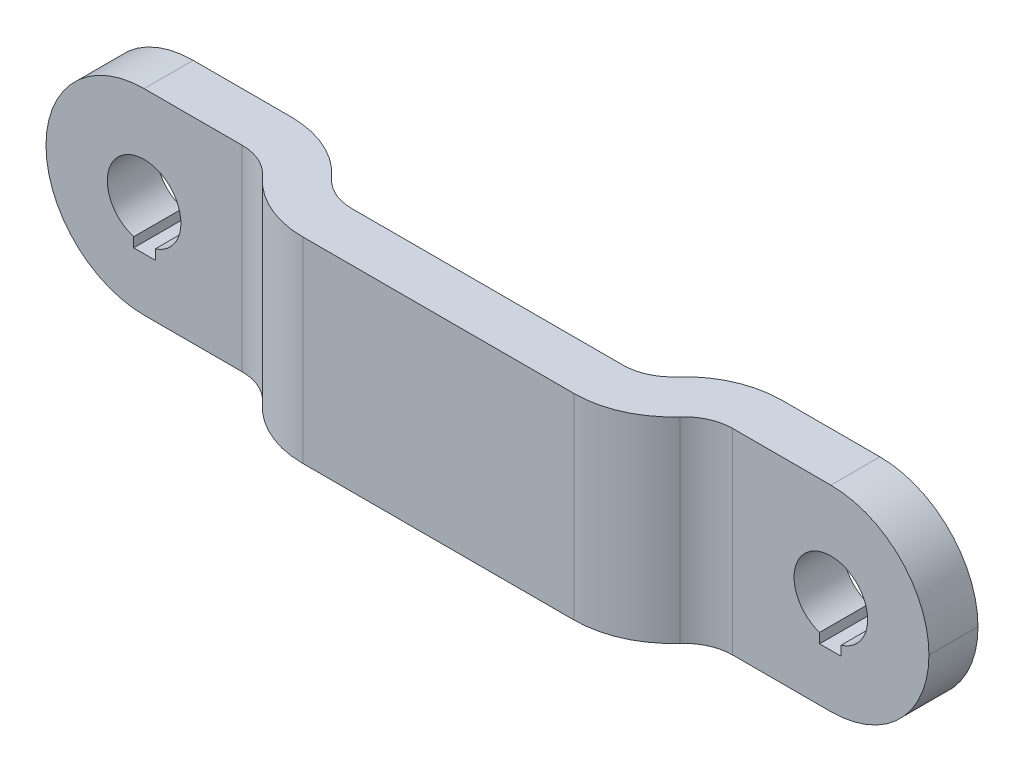
from build123d import *

# Parameters (mm, degrees)
BASE_EXTRUDE_DEPTH = 6.35
FILLET1_R          = 6.35
CUT_EXTRUDE1_DEPTH = 30.443738723


with BuildPart() as part:
    # Sketch1 → Base-Extrude (new, symmetric)
    with BuildSketch(Plane(origin=(0, 0, 0), x_dir=(1, 0, 0), z_dir=(0, 1, 0))):
        with BuildLine():
            Line((-28.575, 0), (-15.875, 0))
            ThreePointArc((-15.875, 0), (-13.282623356, -0.5532696), (-11.141989448, -2.116666667))
            ThreePointArc((-11.141989448, -2.116666667), (-10.071672494, -2.8983652), (-8.775484171, -3.175))
            Line((-8.775484171, -3.175), (8.775484171, -3.175))
            ThreePointArc((8.775484171, -3.175), (10.071672494, -2.8983652), (11.141989448, -2.116666667))
            ThreePointArc((11.141989448, -2.116666667), (13.282623356, -0.5532696), (15.875, 0))
            Line((15.875, 0), (28.575, 0))
            Line((28.575, 0), (28.575, -3.175))
            Line((28.575, -3.175), (15.875, -3.175))
            ThreePointArc((15.875, -3.175), (14.578811678, -3.4516348), (13.508494724, -4.233333333))
            ThreePointArc((13.508494724, -4.233333333), (11.367860816, -5.7967304), (8.775484171, -6.35))
            Line((8.775484171, -6.35), (-8.775484171, -6.35))
            ThreePointArc((-8.775484171, -6.35), (-11.367860816, -5.7967304), (-13.508494724, -4.233333333))
            ThreePointArc((-13.508494724, -4.233333333), (-14.578811678, -3.4516348), (-15.875, -3.175))
            Line((-15.875, -3.175), (-28.575, -3.175))
            Line((-28.575, -3.175), (-28.575, 0))
        make_face()
    extrude(amount=BASE_EXTRUDE_DEPTH, both=True)

    # Fillet1
    fillet1_edges = [part.edges().sort_by_distance(p)[0] for p in [
        (-28.575, 6.35, 1.5875),
        (28.575, 6.35, 1.5875),
        (28.575, -6.35, 1.5875),
        (-28.575, -6.35, 1.5875),
    ]]
    fillet(fillet1_edges, radius=FILLET1_R - 0.0001)  # a hair under: the kernel refuses the full size

    # Sketch2 → Cut-Extrude1 (cut, through all)
    with BuildSketch(Plane.XY.offset(3.175)):
        with BuildLine():
            Line((-22.895630041, -2.284864747), (-22.895630041, -2.908854561))
            Line((-22.895630041, -2.908854561), (-21.498676538, -2.908854561))
            Line((-21.498676538, -2.908854561), (-21.498676538, -2.267775516))
            ThreePointArc((-21.498676538, -2.267775516), (-22.254128161, 2.381071841), (-22.895630041, -2.284864747))
        make_face()
        with BuildLine():
            Line((21.498676538, -2.267775516), (21.498676538, -2.908854561))
            Line((21.498676538, -2.908854561), (22.895630041, -2.908854561))
            Line((22.895630041, -2.908854561), (22.895630041, -2.284864747))
            ThreePointArc((22.895630041, -2.284864747), (22.254128161, 2.381071841), (21.498676538, -2.267775516))
        make_face()
    extrude(amount=-CUT_EXTRUDE1_DEPTH, mode=Mode.SUBTRACT)


solid = part.part
